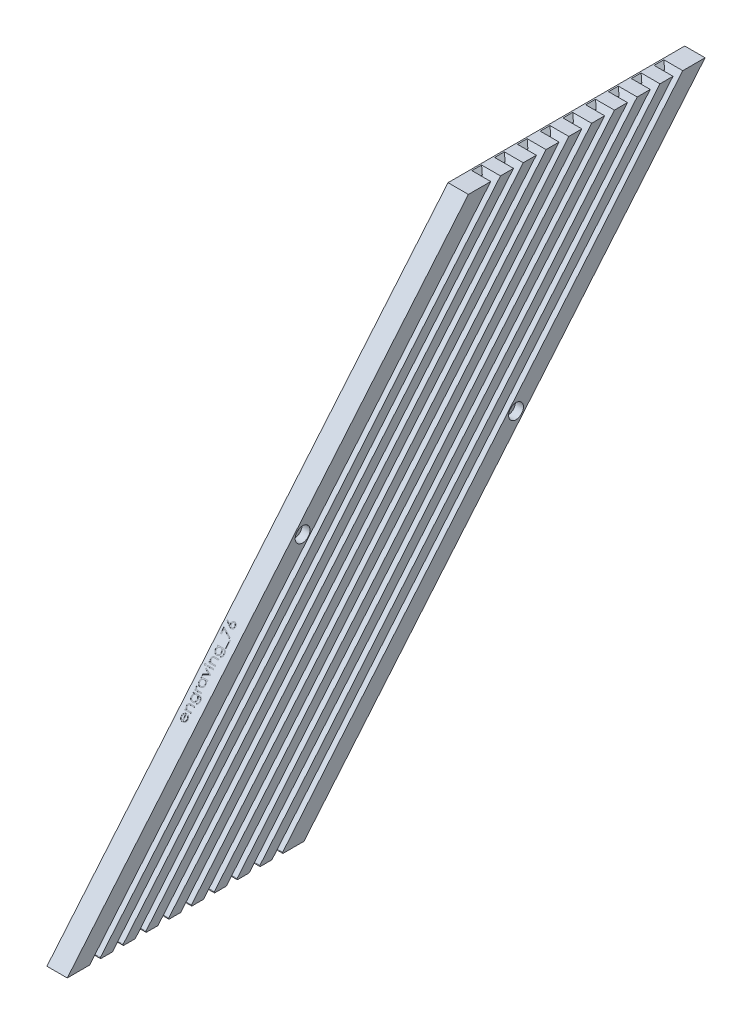
from build123d import *

# Parameters (mm, degrees)
BOSS_EXTRUDE1_DEPTH                                 = 13.673543
SKETCH2_W                                           = 5.003816
SKETCH2_H                                           = 9.673543
CUT_EXTRUDE1_DEPTH                                  = 292.510956164
CHAMFER1_SIZE                                       = 3
FILLET1_R                                           = 0.5
LPATTERN1_COUNT                                     = 9
LPATTERN1_PITCH                                     = 15.300152
CHAMFER1_OF_LPATTERN1_SIZE                          = 3
FILLET1_OF_LPATTERN1_R                              = 0.5
POG_BIENIE_WALCOWE_POD_M5_WKR_T_Z_BEM_W_D           = 5.5
POG_BIENIE_WALCOWE_POD_M5_WKR_T_Z_BEM_W_CBORE_D     = 10
POG_BIENIE_WALCOWE_POD_M5_WKR_T_Z_BEM_W_CBORE_DEPTH = 5.4
SZKIC3_W                                            = 0.538461539
SZKIC3_H                                            = 4.384615385
SZKIC3_W_2                                          = 4.307692308
SZKIC3_H_2                                          = 0.384615385
WYTNIJ_WYCI_GNI_CIE1_DEPTH                          = 0.1


with BuildPart() as part:
    # Boss-Extrude1: read off the stored shape, not the designer's step
    # Boss-Extrude1 outline → Boss-Extrude1 (new body)
    with BuildSketch(Plane(origin=(0, 0, 0), x_dir=(0, 0, -1), z_dir=(1, 0, 0))):
        Polygon((198.628457678, 142), (39.675837577, 142), (-229.675144031, -179), (-70.72252393, -179), align=None)
    extrude(amount=BOSS_EXTRUDE1_DEPTH)

    # Sketch2 → Cut-Extrude1 (cut, symmetric)
    with BuildSketch(Plane(origin=(0, 0, 0), x_dir=(0, -0.6427876096865378, -0.7660444431189795), z_dir=(0, -0.7660444431189793, 0.6427876096865377))):
        with Locations((-46.882385674, 8.8367715)):
            Rectangle(SKETCH2_W, SKETCH2_H)
    cut_extrude1 = extrude(amount=CUT_EXTRUDE1_DEPTH, both=True, mode=Mode.SUBTRACT)

    # Chamfer1
    chamfer1_edges = [part.edges().sort_by_distance(p)[0] for p in [
        (4, 142, -57.951539627),
    ]]
    chamfer(chamfer1_edges, length=CHAMFER1_SIZE)

    # Fillet1
    fillet1_edges = [part.edges().sort_by_distance(p)[0] for p in [
        (8.8367715, -179, 208.13343304),
    ]]
    fillet(fillet1_edges, radius=FILLET1_R)

    # LPattern1: Cut-Extrude1 ×9
    with Locations(*[(0, 0, -i * LPATTERN1_PITCH) for i in range(1, LPATTERN1_COUNT)]):
        add(cut_extrude1, mode=Mode.SUBTRACT)

    # Chamfer1 of LPattern1
    chamfer1_of_lpattern1_edges = [part.edges().sort_by_distance(p)[0] for p in [
        (4, 142, -73.251691627),
        (4, 142, -88.551843627),
        (4, 142, -103.851995627),
        (4, 142, -119.152147627),
        (4, 142, -134.452299627),
        (4, 142, -149.752451627),
        (4, 142, -165.052603627),
        (4, 142, -180.352755627),
    ]]
    chamfer(chamfer1_of_lpattern1_edges, length=CHAMFER1_OF_LPATTERN1_SIZE)

    # Fillet1 of LPattern1
    fillet1_of_lpattern1_edges = [part.edges().sort_by_distance(p)[0] for p in [
        (8.8367715, -179, 192.83328104),
        (8.8367715, -179, 177.53312904),
        (8.8367715, -179, 162.23297704),
        (8.8367715, -179, 146.93282504),
        (8.8367715, -179, 131.63267304),
        (8.8367715, -179, 116.33252104),
        (8.8367715, -179, 101.03236904),
        (8.8367715, -179, 85.73221704),
    ]]
    fillet(fillet1_of_lpattern1_edges, radius=FILLET1_OF_LPATTERN1_R)

    # Pogłębienie walcowe pod M5 Wkręt z łbem walcowym z gniazdem sześciokątnym1 (through all)
    with Locations(Plane(origin=(13.673543, 0, 0), x_dir=(0, 0, -1), z_dir=(1, 0, 0))):
        with Locations((-71.643866315, 0), (71.643866315, 0)):
            CounterBoreHole(POG_BIENIE_WALCOWE_POD_M5_WKR_T_Z_BEM_W_D / 2, POG_BIENIE_WALCOWE_POD_M5_WKR_T_Z_BEM_W_CBORE_D / 2, POG_BIENIE_WALCOWE_POD_M5_WKR_T_Z_BEM_W_CBORE_DEPTH)

    # Szkic3 → Wytnij-wyciągnięcie1 (cut)
    # profile 1 of 13: a face of its own
    with BuildSketch(Plane(origin=(-113.144209161, -42.033178412, 114.746334553), x_dir=(0, 0.7660444431189793, -0.6427876096865379), z_dir=(0, 0.6427876096865379, 0.7660444431189793))):
        with BuildLine():
            Line((-41.876053252, -119.430663267), (-41.397687867, -119.681865191))
            add(Edge.make_bspline(
                [(-41.397687867, -119.681865191), (-41.435807745, -119.74948233), (-41.509973931, -119.881038506), (-41.63751807, -120.061778838), (-41.771218766, -120.224374923), (-41.917111282, -120.364482901), (-42.070830732, -120.486628133), (-42.233229569, -120.593492975), (-42.405153256, -120.684553296), (-42.586609927, -120.761271915), (-42.779123444, -120.820259619), (-42.983160329, -120.861923998), (-43.199111464, -120.887678173), (-43.347133486, -120.890669843), (-43.422928252, -120.892201729)],
                knots=[0, 0, 0, 0, 1.120438281, 2.179929193, 3.190490725, 4.156257408, 5.095198341, 6.022838206, 6.959905092, 7.901321166, 8.864066838, 9.862729781, 10.905609505, 12, 12, 12, 12], degree=3))
            add(Edge.make_bspline(
                [(-43.422928252, -120.892201729), (-43.507171642, -120.890235143), (-43.67150609, -120.886398903), (-43.910717085, -120.853326106), (-44.135938946, -120.799373492), (-44.347159008, -120.724003992), (-44.543860013, -120.625557151), (-44.726432907, -120.50562661), (-44.895837808, -120.364828459), (-45.046736453, -120.201943128), (-45.182583109, -120.027631201), (-45.302455943, -119.845992542), (-45.402668682, -119.657484157), (-45.484187442, -119.463306116), (-45.550024354, -119.264682298), (-45.595910131, -119.059805497), (-45.622361128, -118.849230209), (-45.626414463, -118.706777634), (-45.628457098, -118.634990191)],
                knots=[0, 0, 0, 0, 1.145258523, 2.234067595, 3.276747158, 4.290159414, 5.277019952, 6.260822364, 7.254936242, 8.264827045, 9.274100331, 10.257902744, 11.220704747, 12.172965371, 13.118907548, 14.062713208, 15.023725156, 16, 16, 16, 16], degree=3))
            add(Edge.make_bspline(
                [(-45.628457098, -118.634990191), (-45.626641427, -118.567627624), (-45.623043007, -118.434123913), (-45.600361657, -118.236525837), (-45.560164584, -118.044477061), (-45.505005171, -117.857818007), (-45.433774463, -117.676861206), (-45.346633516, -117.501496526), (-45.243446583, -117.331910572), (-45.163779142, -117.224933771), (-45.123649406, -117.171047883)],
                knots=[0, 0, 0, 0, 1.024358464, 2.0301432, 3.019427413, 4.004406732, 4.986367066, 5.972626655, 6.978780325, 8, 8, 8, 8], degree=3))
            add(Edge.make_bspline(
                [(-45.123649406, -117.171047883), (-45.069293378, -117.10612982), (-44.962303184, -116.978350133), (-44.781349432, -116.810455861), (-44.585406238, -116.669809389), (-44.376929165, -116.553225727), (-44.153495209, -116.464642332), (-43.918107853, -116.398629334), (-43.668086848, -116.361638458), (-43.497163612, -116.3564136), (-43.409707098, -116.353740191)],
                knots=[0, 0, 0, 0, 1.030682036, 2.02871468, 2.997146059, 3.962720338, 4.930598197, 5.918074684, 6.934738563, 8, 8, 8, 8], degree=3))
            add(Edge.make_bspline(
                [(-43.409707098, -116.353740191), (-43.319796917, -116.356061417), (-43.143413639, -116.360615135), (-42.886215717, -116.402831706), (-42.642854488, -116.469778943), (-42.413427338, -116.564328298), (-42.197911006, -116.686316101), (-41.997706349, -116.837416401), (-41.80938947, -117.012990264), (-41.699831907, -117.148012909), (-41.644082098, -117.21672096)],
                knots=[0, 0, 0, 0, 1.056321875, 2.072262726, 3.055038591, 4.01806755, 4.982017516, 5.957941055, 6.960871419, 8, 8, 8, 8], degree=3))
            add(Edge.make_bspline(
                [(-41.644082098, -117.21672096), (-41.606150204, -117.268498528), (-41.530538901, -117.371709017), (-41.435829587, -117.540002429), (-41.35361691, -117.716077734), (-41.287903262, -117.9027811), (-41.234692689, -118.097900381), (-41.196195285, -118.302830457), (-41.173618796, -118.517510305), (-41.169181029, -118.6637844), (-41.166918636, -118.738355575)],
                knots=[0, 0, 0, 0, 0.94817472, 1.890038105, 2.849395472, 3.817997239, 4.812318967, 5.836947057, 6.897266129, 8, 8, 8, 8], degree=3))
            Line((-41.166918636, -118.738355575), (-45.089995559, -118.738355575))
            add(Edge.make_bspline(
                [(-45.089995559, -118.738355575), (-45.087356234, -118.7961278), (-45.082166107, -118.909734549), (-45.057968719, -119.075970177), (-45.019827964, -119.234324478), (-44.966223857, -119.383609693), (-44.901309265, -119.525775626), (-44.821790893, -119.659767689), (-44.726923086, -119.784975569), (-44.621107602, -119.902519233), (-44.50332401, -120.007194824), (-44.379410729, -120.100883583), (-44.247593189, -120.179407463), (-44.10891076, -120.243144417), (-43.9635877, -120.293040959), (-43.811578222, -120.32710008), (-43.653181451, -120.349912263), (-43.545205907, -120.352448832), (-43.490235944, -120.353740191)],
                knots=[0, 0, 0, 0, 1.094153842, 2.151609401, 3.174256925, 4.172055639, 5.149267565, 6.128595816, 7.11444997, 8.118368179, 9.117203808, 10.09244225, 11.054858984, 12.015122123, 12.976791628, 13.957293641, 14.960065497, 16, 16, 16, 16], degree=3))
            add(Edge.make_bspline(
                [(-43.490235944, -120.353740191), (-43.43649112, -120.352697808), (-43.329851078, -120.35062952), (-43.17103818, -120.330517673), (-43.01479899, -120.2979972), (-42.861780161, -120.25361436), (-42.715087283, -120.199482614), (-42.579237768, -120.134163429), (-42.454300256, -120.061906721), (-42.337528313, -119.979261563), (-42.224263753, -119.878104671), (-42.111905205, -119.751872007), (-41.991430942, -119.602579102), (-41.916020212, -119.490215103), (-41.876053252, -119.430663267)],
                knots=[0, 0, 0, 0, 0.99110716, 1.966546729, 2.947904876, 3.932708344, 4.903319531, 5.828989031, 6.710028674, 7.56322171, 8.463672341, 9.504779593, 10.677557249, 12, 12, 12, 12], degree=3))
        make_face()
        with BuildLine():
            add(Edge.make_bspline(
                [(-41.705380175, -118.199894037), (-41.725088674, -118.128471967), (-41.763021191, -117.991007475), (-41.84228353, -117.800651663), (-41.931549028, -117.631472404), (-42.037186282, -117.484764462), (-42.156875526, -117.354472725), (-42.295124411, -117.240612293), (-42.450157371, -117.138753806), (-42.621173041, -117.052778092), (-42.802273244, -116.979595477), (-42.991883858, -116.93052385), (-43.185354352, -116.896907492), (-43.316213128, -116.893777021), (-43.382062867, -116.892201729)],
                knots=[0, 0, 0, 0, 1.154881502, 2.222775134, 3.210006277, 4.132804581, 5.035138423, 5.962687519, 6.919655026, 7.923214229, 8.944639381, 9.960483929, 10.97369054, 12, 12, 12, 12], degree=3))
            add(Edge.make_bspline(
                [(-43.382062867, -116.892201729), (-43.435804762, -116.893250309), (-43.542041189, -116.895323131), (-43.698557306, -116.914986209), (-43.848865361, -116.947488801), (-43.994074425, -116.992000155), (-44.132281628, -117.051329188), (-44.266329802, -117.120900433), (-44.392810482, -117.205828863), (-44.471909845, -117.270558328), (-44.511870559, -117.303259421)],
                knots=[0, 0, 0, 0, 1.04873581, 2.073130211, 3.073294108, 4.04793562, 5.032784715, 6.005352987, 6.992311501, 8, 8, 8, 8], degree=3))
            add(Edge.make_bspline(
                [(-44.511870559, -117.303259421), (-44.540487614, -117.329135391), (-44.598401559, -117.381502047), (-44.67578531, -117.471723544), (-44.749877549, -117.569011936), (-44.817306668, -117.677089293), (-44.879153959, -117.794724914), (-44.937028205, -117.920926574), (-44.989119197, -118.05665194), (-45.018426815, -118.151233265), (-45.033505175, -118.199894037)],
                knots=[0, 0, 0, 0, 0.879870761, 1.780643979, 2.707998968, 3.669668524, 4.684282772, 5.740141944, 6.837334558, 8, 8, 8, 8], degree=3))
            Line((-45.033505175, -118.199894037), (-41.705380175, -118.199894037))
        make_face(mode=Mode.SUBTRACT)
    # profile 2 of 13: a face of its own
    with BuildSketch(Plane(origin=(-113.144209161, -42.033178412, 114.746334553), x_dir=(0, 0.7660444431189793, -0.6427876096865379), z_dir=(0, 0.6427876096865379, 0.7660444431189793))):
        with BuildLine():
            Line((-40.089995559, -116.430663267), (-39.551534021, -116.430663267))
            Line((-39.551534021, -116.430663267), (-39.551534021, -117.221528652))
            add(Edge.make_bspline(
                [(-39.551534021, -117.221528652), (-39.494040932, -117.14979827), (-39.382473588, -117.010602961), (-39.196671873, -116.827653405), (-39.000310901, -116.676890162), (-38.794593181, -116.556712229), (-38.579239449, -116.466118013), (-38.355562415, -116.400690703), (-38.122222919, -116.361459568), (-37.963541027, -116.356333459), (-37.88326479, -116.353740191)],
                knots=[0, 0, 0, 0, 1.12780773, 2.188550248, 3.19190651, 4.159438251, 5.104880172, 6.052711206, 7.014878035, 8, 8, 8, 8], degree=3))
            add(Edge.make_bspline(
                [(-37.88326479, -116.353740191), (-37.80212656, -116.356731954), (-37.643319473, -116.362587557), (-37.412099939, -116.408901885), (-37.19614555, -116.488008036), (-36.996226311, -116.596371586), (-36.816008231, -116.73112554), (-36.657737057, -116.888116023), (-36.526828633, -117.068692166), (-36.439061725, -117.236217577), (-36.381246329, -117.384826938), (-36.344848036, -117.512107081), (-36.313937782, -117.653909626), (-36.2871405, -117.809806064), (-36.269008308, -117.980888676), (-36.254707237, -118.166456148), (-36.244458047, -118.366448372), (-36.244051406, -118.504768305), (-36.243841713, -118.57609596)],
                knots=[0, 0, 0, 0, 1.235846778, 2.418850247, 3.575807741, 4.728682307, 5.871620074, 6.994088408, 8.11269785, 9.256955736, 9.865816715, 10.540099792, 11.271859618, 12.076849838, 12.949306005, 13.892391288, 14.913166135, 16, 16, 16, 16], degree=3))
            Line((-36.243841713, -118.57609596), (-36.243841713, -120.815278652))
            Line((-36.243841713, -120.815278652), (-36.782303252, -120.815278652))
            Line((-36.782303252, -120.815278652), (-36.782303252, -118.752778652))
            add(Edge.make_bspline(
                [(-36.782303252, -118.752778652), (-36.782634465, -118.693083032), (-36.783268021, -118.578895471), (-36.785266272, -118.415405717), (-36.790083084, -118.267143011), (-36.79685162, -118.13446181), (-36.80675853, -118.017489518), (-36.817083041, -117.915987901), (-36.829708715, -117.830085828), (-36.840959423, -117.778374259), (-36.846005175, -117.755182498)],
                knots=[0, 0, 0, 0, 1.430800155, 2.736877192, 3.918605307, 4.986035426, 5.920637409, 6.731861385, 7.431261377, 8, 8, 8, 8], degree=3))
            add(Edge.make_bspline(
                [(-36.846005175, -117.755182498), (-36.864220372, -117.687106181), (-36.89927899, -117.556080333), (-36.985908675, -117.378352872), (-37.095304414, -117.227155978), (-37.228843584, -117.103424455), (-37.385236285, -117.007131592), (-37.56404853, -116.940319099), (-37.763554771, -116.898531209), (-37.90387657, -116.894370411), (-37.97701479, -116.892201729)],
                knots=[0, 0, 0, 0, 1.084156227, 2.086665306, 3.027808233, 3.945421172, 4.874247719, 5.839848303, 6.874090471, 8, 8, 8, 8], degree=3))
            add(Edge.make_bspline(
                [(-37.97701479, -116.892201729), (-38.020330819, -116.893017737), (-38.106052122, -116.894632596), (-38.233166359, -116.910834821), (-38.356464942, -116.93733503), (-38.4771853, -116.973109838), (-38.592912946, -117.022245156), (-38.707366017, -117.078009791), (-38.816234755, -117.147521012), (-38.921840579, -117.224990648), (-39.020091107, -117.310840718), (-39.111511115, -117.401431307), (-39.193004864, -117.49790377), (-39.266836879, -117.59870368), (-39.330571045, -117.705215403), (-39.38620491, -117.816411357), (-39.433408958, -117.932437897), (-39.456865002, -118.012966574), (-39.468601329, -118.053259421)],
                knots=[0, 0, 0, 0, 1.023777757, 2.026029729, 3.023749952, 4.003683103, 4.997618607, 5.993177895, 7.010360494, 8.046726602, 9.087585522, 10.09234134, 11.086953743, 12.070360549, 13.043493632, 14.017870808, 15.008233677, 16, 16, 16, 16], degree=3))
            add(Edge.make_bspline(
                [(-39.468601329, -118.053259421), (-39.475355012, -118.082839769), (-39.490057427, -118.14723464), (-39.505937164, -118.252910787), (-39.52035015, -118.375156459), (-39.532413508, -118.513829002), (-39.539794222, -118.669413931), (-39.547841759, -118.841246796), (-39.550771578, -119.030012776), (-39.551272757, -119.161432821), (-39.551534021, -119.229942114)],
                knots=[0, 0, 0, 0, 0.615963638, 1.340920617, 2.168419149, 3.115676021, 4.16674242, 5.331190069, 6.6087489, 8, 8, 8, 8], degree=3))
            Line((-39.551534021, -119.229942114), (-39.551534021, -120.815278652))
            Line((-39.551534021, -120.815278652), (-40.089995559, -120.815278652))
            Line((-40.089995559, -120.815278652), (-40.089995559, -116.430663267))
        make_face()
    # profile 3 of 13: a face of its own
    with BuildSketch(Plane(origin=(-113.144209161, -42.033178412, 114.746334553), x_dir=(0, 0.7660444431189793, -0.6427876096865379), z_dir=(0, 0.6427876096865379, 0.7660444431189793))):
        with BuildLine():
            Line((-31.166918636, -116.430663267), (-30.628457098, -116.430663267))
            Line((-30.628457098, -116.430663267), (-30.628457098, -119.910230575))
            add(Edge.make_bspline(
                [(-30.628457098, -119.910230575), (-30.628932028, -119.984352166), (-30.629848758, -120.127424691), (-30.636450423, -120.334301741), (-30.650371584, -120.525386459), (-30.666157894, -120.701550331), (-30.688866551, -120.861976806), (-30.716597466, -121.007144585), (-30.74785863, -121.137192978), (-30.77532186, -121.217292705), (-30.788312867, -121.255182498)],
                knots=[0, 0, 0, 0, 1.307562039, 2.523909702, 3.650326591, 4.686913197, 5.643429486, 6.506965704, 7.293745905, 8, 8, 8, 8], degree=3))
            add(Edge.make_bspline(
                [(-30.788312867, -121.255182498), (-30.807494419, -121.304433792), (-30.845284007, -121.401463799), (-30.916059379, -121.539008349), (-30.9953175, -121.668516446), (-31.085843358, -121.789266362), (-31.187227593, -121.900651926), (-31.29708158, -122.005093068), (-31.417544765, -122.100380212), (-31.548548272, -122.184869293), (-31.687072214, -122.260961386), (-31.833036961, -122.326869787), (-31.985619427, -122.384275805), (-32.146252955, -122.427274883), (-32.312419071, -122.464534404), (-32.48607181, -122.488782437), (-32.666196605, -122.505285965), (-32.788674399, -122.506812079), (-32.850812867, -122.507586344)],
                knots=[0, 0, 0, 0, 0.981931301, 1.934503488, 2.87077864, 3.801706999, 4.735015492, 5.667491629, 6.616593066, 7.585388521, 8.561939025, 9.551802639, 10.560317337, 11.588439944, 12.640189604, 13.723962949, 14.845264515, 16, 16, 16, 16], degree=3))
            add(Edge.make_bspline(
                [(-32.850812867, -122.507586344), (-32.941472412, -122.506118083), (-33.118554861, -122.503250174), (-33.376734849, -122.469837177), (-33.621937226, -122.422601109), (-33.850922009, -122.35110609), (-34.062242175, -122.263614107), (-34.254454533, -122.163165617), (-34.425833574, -122.047983944), (-34.580331299, -121.916840057), (-34.719774025, -121.760902317), (-34.850963665, -121.57713287), (-34.977239565, -121.362732489), (-35.051242945, -121.205373552), (-35.089995559, -121.12297096)],
                knots=[0, 0, 0, 0, 1.157897085, 2.2616841, 3.32207898, 4.345638746, 5.321241055, 6.241986252, 7.112515963, 7.955008012, 8.825025602, 9.77857164, 10.836726669, 12, 12, 12, 12], degree=3))
            Line((-35.089995559, -121.12297096), (-34.551534021, -121.12297096))
            add(Edge.make_bspline(
                [(-34.551534021, -121.12297096), (-34.508227376, -121.19172389), (-34.423568219, -121.326127401), (-34.265256538, -121.500149954), (-34.091759978, -121.648870008), (-33.897223378, -121.768717049), (-33.680837295, -121.859076692), (-33.442471547, -121.923491486), (-33.180186481, -121.962056515), (-32.997583828, -121.966704447), (-32.902495559, -121.969124806)],
                knots=[0, 0, 0, 0, 0.997731894, 1.950442991, 2.880492273, 3.800895997, 4.748200782, 5.754801363, 6.83083817, 8, 8, 8, 8], degree=3))
            add(Edge.make_bspline(
                [(-32.902495559, -121.969124806), (-32.808609462, -121.966673122), (-32.627606463, -121.961946522), (-32.367324459, -121.923474274), (-32.129733136, -121.859062674), (-31.916201364, -121.768876869), (-31.729248618, -121.658390458), (-31.568085204, -121.534961759), (-31.437551474, -121.395794325), (-31.349757817, -121.267596943), (-31.295184186, -121.153384149), (-31.26043178, -121.055065413), (-31.23219069, -120.943889052), (-31.208568111, -120.820227789), (-31.189075117, -120.683904949), (-31.176727319, -120.534608829), (-31.16780307, -120.372678733), (-31.167220265, -120.260404782), (-31.166918636, -120.202297883)],
                knots=[0, 0, 0, 0, 1.570740765, 3.028230971, 4.391408896, 5.680370741, 6.894727393, 8.017376726, 9.065722033, 10.075533815, 10.603371122, 11.180248986, 11.817768598, 12.521299649, 13.286540596, 14.121245857, 15.027658897, 16, 16, 16, 16], degree=3))
            Line((-31.166918636, -120.202297883), (-31.166918636, -119.975134421))
            add(Edge.make_bspline(
                [(-31.166918636, -119.975134421), (-31.22157198, -120.040177511), (-31.329917333, -120.169119602), (-31.517027037, -120.338082407), (-31.721398892, -120.483601488), (-31.942684965, -120.602947718), (-32.175464809, -120.698401589), (-32.417217204, -120.765160951), (-32.665775012, -120.808292208), (-32.834207269, -120.812933321), (-32.919322483, -120.815278652)],
                knots=[0, 0, 0, 0, 1.012485704, 2.007162095, 2.997754123, 3.998611389, 4.999708251, 5.992315798, 6.98544096, 8, 8, 8, 8], degree=3))
            add(Edge.make_bspline(
                [(-32.919322483, -120.815278652), (-32.969441802, -120.81439575), (-33.069087329, -120.812640393), (-33.217124038, -120.797282489), (-33.362976218, -120.77499893), (-33.50630371, -120.742287892), (-33.647313333, -120.700302075), (-33.785772062, -120.647816237), (-33.922800965, -120.588476035), (-34.055909247, -120.5185798), (-34.183771185, -120.440815846), (-34.30542236, -120.356577747), (-34.420225569, -120.266306396), (-34.527088123, -120.169111642), (-34.625869845, -120.065134157), (-34.717899333, -119.955482352), (-34.801654786, -119.838625081), (-34.878854881, -119.716693154), (-34.945810682, -119.588874427), (-35.004583891, -119.45794055), (-35.055685728, -119.324171485), (-35.096426417, -119.187119377), (-35.127542611, -119.046870631), (-35.150703, -118.903655004), (-35.163839454, -118.757031482), (-35.165887896, -118.658252027), (-35.166918636, -118.608547883)],
                knots=[0, 0, 0, 0, 1.028754217, 2.045334182, 3.052854819, 4.056607503, 5.061168794, 6.071104265, 7.095078842, 8.125279047, 9.155117945, 10.165957491, 11.161587969, 12.151493252, 13.128948131, 14.104219989, 15.088194871, 16.07871515, 17.064853787, 18.047899887, 19.02414258, 20.002704429, 20.980574569, 21.971845993, 22.979467364, 24, 24, 24, 24], degree=3))
            add(Edge.make_bspline(
                [(-35.166918636, -118.608547883), (-35.166028637, -118.55882829), (-35.164252085, -118.459581675), (-35.148907549, -118.312359871), (-35.127019225, -118.167109411), (-35.092377335, -118.025327453), (-35.050681582, -117.885399308), (-34.999041172, -117.748358525), (-34.93695187, -117.614163367), (-34.866649442, -117.482714456), (-34.787648141, -117.355775687), (-34.701021031, -117.235215723), (-34.606663532, -117.121921714), (-34.505877391, -117.014750705), (-34.39743199, -116.914736716), (-34.281383432, -116.822122491), (-34.158875637, -116.735355589), (-34.029528923, -116.656307582), (-33.895339114, -116.58639516), (-33.759715426, -116.522602136), (-33.620861309, -116.471972217), (-33.481365527, -116.42736119), (-33.338771388, -116.395757998), (-33.194827284, -116.371377012), (-33.04904042, -116.356523205), (-32.951406885, -116.354669059), (-32.902495559, -116.353740191)],
                knots=[0, 0, 0, 0, 1.008818848, 2.013730394, 3.001654427, 3.987803273, 4.973046549, 5.963777569, 6.957074694, 7.972068341, 8.987420212, 9.989399531, 10.982630087, 11.977756091, 12.973280677, 13.973972381, 14.989194003, 16.018387222, 17.047741039, 18.059210846, 19.057554164, 20.045176975, 21.029480261, 22.018708529, 23.007435371, 24, 24, 24, 24], degree=3))
            add(Edge.make_bspline(
                [(-32.902495559, -116.353740191), (-32.821836807, -116.356065916), (-32.662560554, -116.36065851), (-32.42816455, -116.396694759), (-32.201977853, -116.454147353), (-31.982724112, -116.536459863), (-31.768617282, -116.648831357), (-31.560363015, -116.796847839), (-31.357358785, -116.981836993), (-31.232082504, -117.123699046), (-31.166918636, -117.197490191)],
                knots=[0, 0, 0, 0, 0.96728863, 1.910097829, 2.838038873, 3.762875196, 4.71315279, 5.730631239, 6.819562287, 8, 8, 8, 8], degree=3))
            Line((-31.166918636, -117.197490191), (-31.166918636, -116.430663267))
        make_face()
        with BuildLine():
            add(Edge.make_bspline(
                [(-32.859226329, -116.892201729), (-32.937964678, -116.894877841), (-33.093849914, -116.900175976), (-33.322344216, -116.945406913), (-33.542933244, -117.016285599), (-33.751399693, -117.117672939), (-33.946669024, -117.241263062), (-34.119940145, -117.390989269), (-34.27149143, -117.561982749), (-34.399690752, -117.752697458), (-34.501744523, -117.958449931), (-34.573990385, -118.175325475), (-34.620704711, -118.399819748), (-34.625860686, -118.553029925), (-34.628457098, -118.630182498)],
                knots=[0, 0, 0, 0, 1.026226791, 2.031711442, 3.026614839, 4.04107745, 5.047145931, 6.032893242, 7.017642609, 8.019221815, 9.021877557, 10.003543541, 10.994637589, 12, 12, 12, 12], degree=3))
            add(Edge.make_bspline(
                [(-34.628457098, -118.630182498), (-34.627212943, -118.688353823), (-34.624766055, -118.802759807), (-34.601239922, -118.97065334), (-34.56321541, -119.130562449), (-34.509323057, -119.282496806), (-34.442547008, -119.427327883), (-34.358560086, -119.564057999), (-34.259729849, -119.692808924), (-34.146829841, -119.812628379), (-34.022413187, -119.921761467), (-33.887465988, -120.017655251), (-33.742171274, -120.096085058), (-33.590102457, -120.163869352), (-33.427569732, -120.213376325), (-33.256914156, -120.251157089), (-33.076928391, -120.272772102), (-32.95423398, -120.275451184), (-32.891678252, -120.276817114)],
                knots=[0, 0, 0, 0, 1.039728707, 2.044842319, 3.024901384, 3.974314358, 4.923051295, 5.871625912, 6.837440708, 7.820715446, 8.810779094, 9.792721783, 10.773906224, 11.758876063, 12.764959493, 13.806266761, 14.881525401, 16, 16, 16, 16], degree=3))
            add(Edge.make_bspline(
                [(-32.891678252, -120.276817114), (-32.828311809, -120.275501212), (-32.704399402, -120.272927982), (-32.523420654, -120.250807698), (-32.351935956, -120.215112882), (-32.190102546, -120.16443341), (-32.03730939, -120.099767552), (-31.895272908, -120.01793335), (-31.760947569, -119.924737181), (-31.638622295, -119.816030871), (-31.52800944, -119.696228022), (-31.431613839, -119.565865345), (-31.349474784, -119.426904455), (-31.281455921, -119.279361017), (-31.229528143, -119.122088412), (-31.194695734, -118.955479802), (-31.170341314, -118.780333392), (-31.168076872, -118.660318622), (-31.166918636, -118.598932498)],
                knots=[0, 0, 0, 0, 1.121943988, 2.193949579, 3.223793937, 4.220241907, 5.192961521, 6.155822191, 7.11847367, 8.083710714, 9.04790392, 10.001595906, 10.949595423, 11.902125208, 12.873731292, 13.87582262, 14.913508608, 16, 16, 16, 16], degree=3))
            add(Edge.make_bspline(
                [(-31.166918636, -118.598932498), (-31.169215039, -118.519016177), (-31.173701403, -118.362887769), (-31.216039387, -118.135390452), (-31.284302605, -117.921501297), (-31.380039894, -117.721896767), (-31.500009052, -117.538691825), (-31.64450765, -117.37527952), (-31.811043702, -117.23144948), (-31.999138731, -117.111624005), (-32.20150578, -117.014826118), (-32.413256402, -116.942205937), (-32.634076226, -116.901072825), (-32.783744357, -116.89517578), (-32.859226329, -116.892201729)],
                knots=[0, 0, 0, 0, 1.070913519, 2.092188694, 3.091357305, 4.074328408, 5.051968682, 6.018948707, 6.99050112, 7.9935919, 9.000589572, 9.992915277, 10.987769056, 12, 12, 12, 12], degree=3))
        make_face(mode=Mode.SUBTRACT)
    # profile 4 of 13: a face of its own
    with BuildSketch(Plane(origin=(-113.144209161, -42.033178412, 114.746334553), x_dir=(0, 0.7660444431189793, -0.6427876096865379), z_dir=(0, 0.6427876096865379, 0.7660444431189793))):
        with BuildLine():
            Line((-29.551534021, -116.430663267), (-29.013072483, -116.430663267))
            Line((-29.013072483, -116.430663267), (-29.013072483, -117.07609596))
            add(Edge.make_bspline(
                [(-29.013072483, -117.07609596), (-28.973320325, -117.016000254), (-28.897294632, -116.901067684), (-28.77092961, -116.749063168), (-28.641495328, -116.623208802), (-28.508372149, -116.522917056), (-28.370581121, -116.447808852), (-28.231146347, -116.392792221), (-28.087874113, -116.36025968), (-27.991596528, -116.355916265), (-27.943360944, -116.353740191)],
                knots=[0, 0, 0, 0, 1.2804753, 2.448899062, 3.506932113, 4.484331642, 5.4025378, 6.288909075, 7.142734305, 8, 8, 8, 8], degree=3))
            add(Edge.make_bspline(
                [(-27.943360944, -116.353740191), (-27.905944384, -116.355781093), (-27.828957381, -116.359980383), (-27.712415799, -116.389484654), (-27.59234131, -116.436589836), (-27.51495436, -116.48088736), (-27.474610944, -116.503980575)],
                knots=[0, 0, 0, 0, 0.901110191, 1.854092781, 2.881294221, 4, 4, 4, 4], degree=3))
            Line((-27.474610944, -116.503980575), (-27.770284021, -116.970326729))
            add(Edge.make_bspline(
                [(-27.770284021, -116.970326729), (-27.7961852, -116.958771987), (-27.845350596, -116.936838875), (-27.91727271, -116.910881143), (-27.983583573, -116.895596716), (-28.025829673, -116.8932812), (-28.045524406, -116.892201729)],
                knots=[0, 0, 0, 0, 1.180555205, 2.24091978, 3.179933427, 4, 4, 4, 4], degree=3))
            add(Edge.make_bspline(
                [(-28.045524406, -116.892201729), (-28.088734234, -116.895081793), (-28.17686976, -116.900956289), (-28.306271759, -116.947137102), (-28.431838397, -117.0217518), (-28.531561247, -117.104502277), (-28.608776537, -117.184298501), (-28.663874067, -117.253981477), (-28.714415919, -117.332116274), (-28.762707725, -117.41736716), (-28.806707087, -117.511189754), (-28.847772234, -117.612646691), (-28.884901713, -117.721855483), (-28.906073561, -117.797939804), (-28.916918636, -117.836913267)],
                knots=[0, 0, 0, 0, 1.125678352, 2.296057538, 3.5422874, 4.923748041, 5.663163013, 6.437101912, 7.23742474, 8.08941207, 8.991984279, 9.93940061, 10.944477711, 12, 12, 12, 12], degree=3))
            add(Edge.make_bspline(
                [(-28.916918636, -117.836913267), (-28.925031311, -117.871674136), (-28.943000268, -117.94866682), (-28.960471476, -118.077835719), (-28.977733506, -118.230447706), (-28.989899138, -118.406927579), (-29.001175782, -118.606834626), (-29.007535923, -118.83047339), (-29.012855592, -119.07807342), (-29.012997992, -119.251172312), (-29.013072483, -119.34172096)],
                knots=[0, 0, 0, 0, 0.566838948, 1.255505196, 2.06880316, 3.007127437, 4.065329342, 5.249902469, 6.561414163, 8, 8, 8, 8], degree=3))
            Line((-29.013072483, -119.34172096), (-29.013072483, -120.815278652))
            Line((-29.013072483, -120.815278652), (-29.551534021, -120.815278652))
            Line((-29.551534021, -120.815278652), (-29.551534021, -116.430663267))
        make_face()
    # profile 5 of 13: a face of its own
    with BuildSketch(Plane(origin=(-113.144209161, -42.033178412, 114.746334553), x_dir=(0, 0.7660444431189793, -0.6427876096865379), z_dir=(0, 0.6427876096865379, 0.7660444431189793))):
        with BuildLine():
            Line((-22.474610944, -116.430663267), (-22.474610944, -120.815278652))
            Line((-22.474610944, -120.815278652), (-23.013072483, -120.815278652))
            Line((-23.013072483, -120.815278652), (-23.013072483, -120.056865191))
            add(Edge.make_bspline(
                [(-23.013072483, -120.056865191), (-23.073790409, -120.125504494), (-23.192282207, -120.259454959), (-23.390181266, -120.434452969), (-23.599955286, -120.57910152), (-23.820586122, -120.695929947), (-24.051874539, -120.783687758), (-24.293307831, -120.846064031), (-24.544984484, -120.886167748), (-24.716845664, -120.890172357), (-24.803937867, -120.892201729)],
                knots=[0, 0, 0, 0, 1.074387032, 2.096679803, 3.090159297, 4.057316773, 5.018401886, 5.985159533, 6.978961417, 8, 8, 8, 8], degree=3))
            add(Edge.make_bspline(
                [(-24.803937867, -120.892201729), (-24.881368645, -120.890099377), (-25.034065568, -120.885953444), (-25.258686843, -120.853789495), (-25.474844985, -120.802137001), (-25.682744252, -120.730306905), (-25.881039359, -120.635025496), (-26.071428096, -120.520954785), (-26.252924139, -120.385113362), (-26.422761063, -120.229819599), (-26.579158778, -120.061142479), (-26.716406674, -119.881235827), (-26.830840525, -119.690877592), (-26.926532092, -119.492477899), (-27.000240111, -119.284509466), (-27.051623484, -119.067691464), (-27.083749964, -118.842280252), (-27.087894183, -118.688783926), (-27.089995559, -118.610951729)],
                knots=[0, 0, 0, 0, 1.033919861, 2.038935746, 3.024066025, 3.998881131, 4.97069526, 5.957263378, 6.95902576, 7.993208707, 9.027059324, 10.027763471, 11.009749337, 11.988697705, 12.965288445, 13.950418724, 14.960734635, 16, 16, 16, 16], degree=3))
            add(Edge.make_bspline(
                [(-27.089995559, -118.610951729), (-27.087847608, -118.534728237), (-27.083601225, -118.384038506), (-27.051967134, -118.162417881), (-26.998771119, -117.948958005), (-26.924117666, -117.744346102), (-26.828388601, -117.548334588), (-26.711940451, -117.360784831), (-26.574764809, -117.181180149), (-26.416617826, -117.013743761), (-26.245301077, -116.85907985), (-26.062028967, -116.724664344), (-25.871360484, -116.608578317), (-25.670338181, -116.516600929), (-25.461937429, -116.442185322), (-25.244302951, -116.390700233), (-25.018340245, -116.360361968), (-24.864927973, -116.355968658), (-24.787110944, -116.353740191)],
                knots=[0, 0, 0, 0, 1.020392517, 2.01726096, 2.990465484, 3.961182959, 4.928053699, 5.906110375, 6.912531644, 7.948652711, 8.985773172, 9.998621852, 10.987621588, 11.969261332, 12.953316658, 13.946091881, 14.958173133, 16, 16, 16, 16], degree=3))
            add(Edge.make_bspline(
                [(-24.787110944, -116.353740191), (-24.697625471, -116.356204907), (-24.522148683, -116.361038101), (-24.265472096, -116.401259919), (-24.022652991, -116.469211577), (-23.791816958, -116.561641574), (-23.573792925, -116.684467967), (-23.370644952, -116.839405043), (-23.180246981, -117.025475649), (-23.069880766, -117.168396411), (-23.013072483, -117.241961344)],
                knots=[0, 0, 0, 0, 1.038897134, 2.037228247, 3.008116434, 3.962042015, 4.918381754, 5.904844433, 6.921570401, 8, 8, 8, 8], degree=3))
            Line((-23.013072483, -117.241961344), (-23.013072483, -116.430663267))
            Line((-23.013072483, -116.430663267), (-22.474610944, -116.430663267))
        make_face()
        with BuildLine():
            add(Edge.make_bspline(
                [(-24.779899406, -116.892201729), (-24.858609699, -116.895002251), (-25.013971299, -116.900530035), (-25.242046731, -116.943684599), (-25.460298298, -117.01548676), (-25.667634425, -117.113684305), (-25.86077994, -117.237162139), (-26.033397661, -117.386513082), (-26.186899435, -117.557662249), (-26.315999316, -117.749837296), (-26.421240168, -117.95585688), (-26.495240794, -118.17121306), (-26.544045219, -118.392021593), (-26.549031254, -118.541786197), (-26.551534021, -118.616961344)],
                knots=[0, 0, 0, 0, 1.031046209, 2.035121221, 3.029706178, 4.034933723, 5.034054252, 6.02443088, 7.017295772, 8.038157696, 9.050218397, 10.03989886, 11.016116709, 12, 12, 12, 12], degree=3))
            add(Edge.make_bspline(
                [(-26.551534021, -118.616961344), (-26.548337061, -118.691687242), (-26.541955672, -118.840846138), (-26.496097339, -119.061955698), (-26.419160413, -119.277362628), (-26.31417402, -119.485238616), (-26.182711234, -119.678239931), (-26.030330687, -119.85265157), (-25.855558776, -120.002633721), (-25.661968764, -120.128183848), (-25.455212244, -120.229605312), (-25.237782647, -120.30017498), (-25.013767267, -120.345736889), (-24.86144898, -120.35105885), (-24.784707098, -120.353740191)],
                knots=[0, 0, 0, 0, 0.979072187, 1.954306742, 2.945804271, 3.96968567, 4.997920485, 5.998718438, 6.996577872, 8.005894225, 9.015743152, 10.005417472, 10.995077863, 12, 12, 12, 12], degree=3))
            add(Edge.make_bspline(
                [(-24.784707098, -120.353740191), (-24.706798807, -120.350894538), (-24.551846945, -120.345234818), (-24.323094874, -120.301895506), (-24.101103509, -120.230291851), (-23.888896832, -120.131036206), (-23.691212036, -120.008023595), (-23.513787103, -119.864011439), (-23.363759729, -119.696520267), (-23.236572398, -119.512446347), (-23.136843112, -119.310654353), (-23.064198439, -119.09579574), (-23.021248886, -118.867863029), (-23.015835636, -118.712096297), (-23.013072483, -118.632586344)],
                knots=[0, 0, 0, 0, 1.01762866, 2.023962475, 3.030623092, 4.058876274, 5.077231937, 6.066672613, 7.034107872, 8.005628644, 8.981990164, 9.965428785, 10.961468474, 12, 12, 12, 12], degree=3))
            add(Edge.make_bspline(
                [(-23.013072483, -118.632586344), (-23.014717608, -118.572007206), (-23.017955735, -118.452768292), (-23.042693854, -118.277692548), (-23.082045156, -118.110149017), (-23.137495734, -117.94996155), (-23.210337935, -117.79801581), (-23.298191248, -117.653220792), (-23.402600591, -117.516329573), (-23.521885213, -117.389227165), (-23.652454131, -117.273296087), (-23.790616201, -117.169814532), (-23.938008339, -117.084805207), (-24.09215183, -117.014448741), (-24.253314118, -116.958461627), (-24.422806609, -116.921111295), (-24.59882773, -116.895465031), (-24.718906682, -116.893300949), (-24.779899406, -116.892201729)],
                knots=[0, 0, 0, 0, 1.050140795, 2.067009409, 3.05949893, 4.030605086, 5.00011959, 5.97591094, 6.962425594, 7.979863591, 8.993523472, 9.986985069, 10.967611495, 11.937549037, 12.921786183, 13.919465291, 14.943216303, 16, 16, 16, 16], degree=3))
        make_face(mode=Mode.SUBTRACT)
    # profile 6 of 13: a face of its own
    with BuildSketch(Plane(origin=(-113.144209161, -42.033178412, 114.746334553), x_dir=(0, 0.7660444431189793, -0.6427876096865379), z_dir=(0, 0.6427876096865379, 0.7660444431189793))):
        Polygon((-21.705380175, -116.430663267), (-21.122447483, -116.430663267), (-19.666918636, -119.62297096), (-18.21138979, -116.430663267), (-17.628457098, -116.430663267), (-19.628457098, -120.815278652), (-19.705380175, -120.815278652), align=None)
    # profile 7 of 13: a face of its own
    with BuildSketch(Plane(origin=(-113.144209161, -42.033178412, 114.746334553), x_dir=(0, 0.7660444431189793, -0.6427876096865379), z_dir=(0, 0.6427876096865379, 0.7660444431189793))):
        with BuildLine():
            add(Edge.make_bspline(
                [(-16.515476329, -114.584509421), (-16.482062644, -114.586059397), (-16.416632233, -114.589094547), (-16.322015203, -114.61508565), (-16.235860325, -114.659142254), (-16.159441354, -114.718250278), (-16.093866692, -114.78776361), (-16.047956902, -114.868782413), (-16.018449938, -114.956311508), (-16.0148867, -115.017365946), (-16.013072483, -115.048451729)],
                knots=[0, 0, 0, 0, 1.055194115, 2.066272739, 3.074728998, 4.095836921, 5.109056067, 6.073838105, 7.019297344, 8, 8, 8, 8], degree=3))
            add(Edge.make_bspline(
                [(-16.013072483, -115.048451729), (-16.014927614, -115.078730563), (-16.018594988, -115.138588234), (-16.047934111, -115.224599901), (-16.094257947, -115.304492958), (-16.159399306, -115.373871319), (-16.235871467, -115.432946667), (-16.322012243, -115.477011934), (-16.416633012, -115.503000741), (-16.482062908, -115.506036207), (-16.515476329, -115.507586344)],
                knots=[0, 0, 0, 0, 0.96129708, 1.900370562, 2.859976407, 3.87933698, 4.906634145, 5.921202961, 6.938410037, 8, 8, 8, 8], degree=3))
            add(Edge.make_bspline(
                [(-16.515476329, -115.507586344), (-16.548507658, -115.506095395), (-16.612798824, -115.503193458), (-16.705999125, -115.476501999), (-16.791419392, -115.432931588), (-16.867987402, -115.374258128), (-16.931810591, -115.304066876), (-16.978264863, -115.224648657), (-17.007536226, -115.138575821), (-17.011212732, -115.078726393), (-17.013072483, -115.048451729)],
                knots=[0, 0, 0, 0, 1.054934014, 2.053291228, 3.073705704, 4.106921865, 5.123545215, 6.088680038, 7.033164197, 8, 8, 8, 8], degree=3))
            add(Edge.make_bspline(
                [(-17.013072483, -115.048451729), (-17.011253477, -115.017370273), (-17.007680835, -114.956324331), (-16.978242922, -114.868732846), (-16.932197537, -114.788193129), (-16.867945142, -114.717863701), (-16.791430639, -114.659157241), (-16.705996219, -114.615595559), (-16.612799591, -114.588901834), (-16.548507918, -114.58600021), (-16.515476329, -114.584509421)],
                knots=[0, 0, 0, 0, 0.98631895, 1.937192651, 2.907499808, 3.917963147, 4.944918757, 5.95915025, 6.951458133, 8, 8, 8, 8], degree=3))
        make_face()
    # profile 8 of 13: a face of its own
    with BuildSketch(Plane(origin=(-113.144209161, -42.033178412, 114.746334553), x_dir=(0, 0.7660444431189793, -0.6427876096865379), z_dir=(0, 0.6427876096865379, 0.7660444431189793))):
        with Locations((-16.513072483, -118.62297096)):
            Rectangle(SZKIC3_W, SZKIC3_H)
    # profile 9 of 13: a face of its own
    with BuildSketch(Plane(origin=(-113.144209161, -42.033178412, 114.746334553), x_dir=(0, 0.7660444431189793, -0.6427876096865379), z_dir=(0, 0.6427876096865379, 0.7660444431189793))):
        with BuildLine():
            Line((-14.936149406, -116.430663267), (-14.397687867, -116.430663267))
            Line((-14.397687867, -116.430663267), (-14.397687867, -117.221528652))
            add(Edge.make_bspline(
                [(-14.397687867, -117.221528652), (-14.340194778, -117.14979827), (-14.228627434, -117.010602961), (-14.042825719, -116.827653405), (-13.846464748, -116.676890162), (-13.640747027, -116.556712229), (-13.425393296, -116.466118013), (-13.201716261, -116.400690703), (-12.968376765, -116.361459568), (-12.809694873, -116.356333459), (-12.729418636, -116.353740191)],
                knots=[0, 0, 0, 0, 1.12780773, 2.188550248, 3.19190651, 4.159438251, 5.104880172, 6.052711206, 7.014878035, 8, 8, 8, 8], degree=3))
            add(Edge.make_bspline(
                [(-12.729418636, -116.353740191), (-12.648280406, -116.356731954), (-12.489473319, -116.362587557), (-12.258253785, -116.408901885), (-12.042299396, -116.488008036), (-11.842380157, -116.596371586), (-11.662162077, -116.73112554), (-11.503890903, -116.888116023), (-11.372982479, -117.068692166), (-11.285215571, -117.236217577), (-11.227400175, -117.384826938), (-11.191001882, -117.512107081), (-11.160091628, -117.653909626), (-11.133294346, -117.809806064), (-11.115162154, -117.980888676), (-11.100861083, -118.166456148), (-11.090611893, -118.366448372), (-11.090205252, -118.504768305), (-11.089995559, -118.57609596)],
                knots=[0, 0, 0, 0, 1.235846778, 2.418850247, 3.575807741, 4.728682307, 5.871620074, 6.994088408, 8.11269785, 9.256955736, 9.865816715, 10.540099792, 11.271859618, 12.076849838, 12.949306005, 13.892391288, 14.913166135, 16, 16, 16, 16], degree=3))
            Line((-11.089995559, -118.57609596), (-11.089995559, -120.815278652))
            Line((-11.089995559, -120.815278652), (-11.628457098, -120.815278652))
            Line((-11.628457098, -120.815278652), (-11.628457098, -118.752778652))
            add(Edge.make_bspline(
                [(-11.628457098, -118.752778652), (-11.628788312, -118.693083032), (-11.629421867, -118.578895471), (-11.631420119, -118.415405717), (-11.63623693, -118.267143011), (-11.643005466, -118.13446181), (-11.652912376, -118.017489518), (-11.663236887, -117.915987901), (-11.675862561, -117.830085828), (-11.687113269, -117.778374259), (-11.692159021, -117.755182498)],
                knots=[0, 0, 0, 0, 1.430800155, 2.736877192, 3.918605307, 4.986035426, 5.920637409, 6.731861385, 7.431261377, 8, 8, 8, 8], degree=3))
            add(Edge.make_bspline(
                [(-11.692159021, -117.755182498), (-11.710374218, -117.687106181), (-11.745432836, -117.556080333), (-11.832062522, -117.378352872), (-11.94145826, -117.227155978), (-12.07499743, -117.103424455), (-12.231390131, -117.007131592), (-12.410202376, -116.940319099), (-12.609708617, -116.898531209), (-12.750030416, -116.894370411), (-12.823168636, -116.892201729)],
                knots=[0, 0, 0, 0, 1.084156227, 2.086665306, 3.027808233, 3.945421172, 4.874247719, 5.839848303, 6.874090471, 8, 8, 8, 8], degree=3))
            add(Edge.make_bspline(
                [(-12.823168636, -116.892201729), (-12.866484665, -116.893017737), (-12.952205968, -116.894632596), (-13.079320205, -116.910834821), (-13.202618788, -116.93733503), (-13.323339146, -116.973109838), (-13.439066793, -117.022245156), (-13.553519863, -117.078009791), (-13.662388602, -117.147521012), (-13.767994425, -117.224990648), (-13.866244953, -117.310840718), (-13.957664961, -117.401431307), (-14.03915871, -117.49790377), (-14.112990725, -117.59870368), (-14.176724891, -117.705215403), (-14.232358756, -117.816411357), (-14.279562804, -117.932437897), (-14.303018849, -118.012966574), (-14.314755175, -118.053259421)],
                knots=[0, 0, 0, 0, 1.023777757, 2.026029729, 3.023749952, 4.003683103, 4.997618607, 5.993177895, 7.010360494, 8.046726602, 9.087585522, 10.09234134, 11.086953743, 12.070360549, 13.043493632, 14.017870808, 15.008233677, 16, 16, 16, 16], degree=3))
            add(Edge.make_bspline(
                [(-14.314755175, -118.053259421), (-14.321508858, -118.082839769), (-14.336211273, -118.14723464), (-14.35209101, -118.252910787), (-14.366503997, -118.375156459), (-14.378567354, -118.513829002), (-14.385948068, -118.669413931), (-14.393995605, -118.841246796), (-14.396925424, -119.030012776), (-14.397426603, -119.161432821), (-14.397687867, -119.229942114)],
                knots=[0, 0, 0, 0, 0.615963638, 1.340920617, 2.168419149, 3.115676021, 4.16674242, 5.331190069, 6.6087489, 8, 8, 8, 8], degree=3))
            Line((-14.397687867, -119.229942114), (-14.397687867, -120.815278652))
            Line((-14.397687867, -120.815278652), (-14.936149406, -120.815278652))
            Line((-14.936149406, -120.815278652), (-14.936149406, -116.430663267))
        make_face()
    # profile 10 of 13: a face of its own
    with BuildSketch(Plane(origin=(-113.144209161, -42.033178412, 114.746334553), x_dir=(0, 0.7660444431189793, -0.6427876096865379), z_dir=(0, 0.6427876096865379, 0.7660444431189793))):
        with BuildLine():
            Line((-6.013072483, -116.430663267), (-5.474610944, -116.430663267))
            Line((-5.474610944, -116.430663267), (-5.474610944, -119.910230575))
            add(Edge.make_bspline(
                [(-5.474610944, -119.910230575), (-5.475085874, -119.984352166), (-5.476002604, -120.127424691), (-5.482604269, -120.334301741), (-5.49652543, -120.525386459), (-5.512311741, -120.701550331), (-5.535020397, -120.861976806), (-5.562751312, -121.007144585), (-5.594012477, -121.137192978), (-5.621475707, -121.217292705), (-5.634466713, -121.255182498)],
                knots=[0, 0, 0, 0, 1.307562039, 2.523909702, 3.650326591, 4.686913197, 5.643429486, 6.506965704, 7.293745905, 8, 8, 8, 8], degree=3))
            add(Edge.make_bspline(
                [(-5.634466713, -121.255182498), (-5.653648265, -121.304433792), (-5.691437854, -121.401463799), (-5.762213225, -121.539008349), (-5.841471346, -121.668516446), (-5.931997204, -121.789266362), (-6.033381439, -121.900651926), (-6.143235426, -122.005093068), (-6.263698611, -122.100380212), (-6.394702118, -122.184869293), (-6.533226061, -122.260961386), (-6.679190807, -122.326869787), (-6.831773273, -122.384275805), (-6.992406801, -122.427274883), (-7.158572917, -122.464534404), (-7.332225656, -122.488782437), (-7.512350451, -122.505285965), (-7.634828245, -122.506812079), (-7.696966713, -122.507586344)],
                knots=[0, 0, 0, 0, 0.981931301, 1.934503488, 2.87077864, 3.801706999, 4.735015492, 5.667491629, 6.616593066, 7.585388521, 8.561939025, 9.551802639, 10.560317337, 11.588439944, 12.640189604, 13.723962949, 14.845264515, 16, 16, 16, 16], degree=3))
            add(Edge.make_bspline(
                [(-7.696966713, -122.507586344), (-7.787626258, -122.506118083), (-7.964708707, -122.503250174), (-8.222888695, -122.469837177), (-8.468091072, -122.422601109), (-8.697075855, -122.35110609), (-8.908396021, -122.263614107), (-9.100608379, -122.163165617), (-9.27198742, -122.047983944), (-9.426485145, -121.916840057), (-9.565927871, -121.760902317), (-9.697117511, -121.57713287), (-9.823393412, -121.362732489), (-9.897396791, -121.205373552), (-9.936149406, -121.12297096)],
                knots=[0, 0, 0, 0, 1.157897085, 2.2616841, 3.32207898, 4.345638746, 5.321241055, 6.241986252, 7.112515963, 7.955008012, 8.825025602, 9.77857164, 10.836726669, 12, 12, 12, 12], degree=3))
            Line((-9.936149406, -121.12297096), (-9.397687867, -121.12297096))
            add(Edge.make_bspline(
                [(-9.397687867, -121.12297096), (-9.354381223, -121.19172389), (-9.269722065, -121.326127401), (-9.111410384, -121.500149954), (-8.937913824, -121.648870008), (-8.743377224, -121.768717049), (-8.526991141, -121.859076692), (-8.288625393, -121.923491486), (-8.026340327, -121.962056515), (-7.843737674, -121.966704447), (-7.748649406, -121.969124806)],
                knots=[0, 0, 0, 0, 0.997731894, 1.950442991, 2.880492273, 3.800895997, 4.748200782, 5.754801363, 6.83083817, 8, 8, 8, 8], degree=3))
            add(Edge.make_bspline(
                [(-7.748649406, -121.969124806), (-7.654763308, -121.966673122), (-7.473760309, -121.961946522), (-7.213478305, -121.923474274), (-6.975886983, -121.859062674), (-6.76235521, -121.768876869), (-6.575402464, -121.658390458), (-6.41423905, -121.534961759), (-6.28370532, -121.395794325), (-6.195911663, -121.267596943), (-6.141338032, -121.153384149), (-6.106585627, -121.055065413), (-6.078344536, -120.943889052), (-6.054721957, -120.820227789), (-6.035228963, -120.683904949), (-6.022881165, -120.534608829), (-6.013956916, -120.372678733), (-6.013374111, -120.260404782), (-6.013072483, -120.202297883)],
                knots=[0, 0, 0, 0, 1.570740765, 3.028230971, 4.391408896, 5.680370741, 6.894727393, 8.017376726, 9.065722033, 10.075533815, 10.603371122, 11.180248986, 11.817768598, 12.521299649, 13.286540596, 14.121245857, 15.027658897, 16, 16, 16, 16], degree=3))
            Line((-6.013072483, -120.202297883), (-6.013072483, -119.975134421))
            add(Edge.make_bspline(
                [(-6.013072483, -119.975134421), (-6.067725827, -120.040177511), (-6.176071179, -120.169119602), (-6.363180883, -120.338082407), (-6.567552738, -120.483601488), (-6.788838811, -120.602947718), (-7.021618655, -120.698401589), (-7.26337105, -120.765160951), (-7.511928859, -120.808292208), (-7.680361115, -120.812933321), (-7.765476329, -120.815278652)],
                knots=[0, 0, 0, 0, 1.012485704, 2.007162095, 2.997754123, 3.998611389, 4.999708251, 5.992315798, 6.98544096, 8, 8, 8, 8], degree=3))
            add(Edge.make_bspline(
                [(-7.765476329, -120.815278652), (-7.815595648, -120.81439575), (-7.915241175, -120.812640393), (-8.063277884, -120.797282489), (-8.209130064, -120.77499893), (-8.352457556, -120.742287892), (-8.493467179, -120.700302075), (-8.631925908, -120.647816237), (-8.768954811, -120.588476035), (-8.902063093, -120.5185798), (-9.029925031, -120.440815846), (-9.151576206, -120.356577747), (-9.266379416, -120.266306396), (-9.373241969, -120.169111642), (-9.472023691, -120.065134157), (-9.56405318, -119.955482352), (-9.647808632, -119.838625081), (-9.725008728, -119.716693154), (-9.791964528, -119.588874427), (-9.850737737, -119.45794055), (-9.901839574, -119.324171485), (-9.942580263, -119.187119377), (-9.973696457, -119.046870631), (-9.996856846, -118.903655004), (-10.0099933, -118.757031482), (-10.012041742, -118.658252027), (-10.013072483, -118.608547883)],
                knots=[0, 0, 0, 0, 1.028754217, 2.045334182, 3.052854819, 4.056607503, 5.061168794, 6.071104265, 7.095078842, 8.125279047, 9.155117945, 10.165957491, 11.161587969, 12.151493252, 13.128948131, 14.104219989, 15.088194871, 16.07871515, 17.064853787, 18.047899887, 19.02414258, 20.002704429, 20.980574569, 21.971845993, 22.979467364, 24, 24, 24, 24], degree=3))
            add(Edge.make_bspline(
                [(-10.013072483, -118.608547883), (-10.012182483, -118.55882829), (-10.010405932, -118.459581675), (-9.995061396, -118.312359871), (-9.973173071, -118.167109411), (-9.938531181, -118.025327453), (-9.896835428, -117.885399308), (-9.845195018, -117.748358525), (-9.783105716, -117.614163367), (-9.712803288, -117.482714456), (-9.633801987, -117.355775687), (-9.547174877, -117.235215723), (-9.452817378, -117.121921714), (-9.352031237, -117.014750705), (-9.243585836, -116.914736716), (-9.127537278, -116.822122491), (-9.005029483, -116.735355589), (-8.875682769, -116.656307582), (-8.74149296, -116.58639516), (-8.605869273, -116.522602136), (-8.467015155, -116.471972217), (-8.327519373, -116.42736119), (-8.184925234, -116.395757998), (-8.040981131, -116.371377012), (-7.895194266, -116.356523205), (-7.797560731, -116.354669059), (-7.748649406, -116.353740191)],
                knots=[0, 0, 0, 0, 1.008818848, 2.013730394, 3.001654427, 3.987803273, 4.973046549, 5.963777569, 6.957074694, 7.972068341, 8.987420212, 9.989399531, 10.982630087, 11.977756091, 12.973280677, 13.973972381, 14.989194003, 16.018387222, 17.047741039, 18.059210846, 19.057554164, 20.045176975, 21.029480261, 22.018708529, 23.007435371, 24, 24, 24, 24], degree=3))
            add(Edge.make_bspline(
                [(-7.748649406, -116.353740191), (-7.667990653, -116.356065916), (-7.508714401, -116.36065851), (-7.274318396, -116.396694759), (-7.048131699, -116.454147353), (-6.828877958, -116.536459863), (-6.614771128, -116.648831357), (-6.406516862, -116.796847839), (-6.203512632, -116.981836993), (-6.078236351, -117.123699046), (-6.013072483, -117.197490191)],
                knots=[0, 0, 0, 0, 0.96728863, 1.910097829, 2.838038873, 3.762875196, 4.71315279, 5.730631239, 6.819562287, 8, 8, 8, 8], degree=3))
            Line((-6.013072483, -117.197490191), (-6.013072483, -116.430663267))
        make_face()
        with BuildLine():
            add(Edge.make_bspline(
                [(-7.705380175, -116.892201729), (-7.784118524, -116.894877841), (-7.94000376, -116.900175976), (-8.168498062, -116.945406913), (-8.389087091, -117.016285599), (-8.597553539, -117.117672939), (-8.79282287, -117.241263062), (-8.966093991, -117.390989269), (-9.117645276, -117.561982749), (-9.245844599, -117.752697458), (-9.34789837, -117.958449931), (-9.420144232, -118.175325475), (-9.466858557, -118.399819748), (-9.472014532, -118.553029925), (-9.474610944, -118.630182498)],
                knots=[0, 0, 0, 0, 1.026226791, 2.031711442, 3.026614839, 4.04107745, 5.047145931, 6.032893242, 7.017642609, 8.019221815, 9.021877557, 10.003543541, 10.994637589, 12, 12, 12, 12], degree=3))
            add(Edge.make_bspline(
                [(-9.474610944, -118.630182498), (-9.473366789, -118.688353823), (-9.470919901, -118.802759807), (-9.447393768, -118.97065334), (-9.409369256, -119.130562449), (-9.355476903, -119.282496806), (-9.288700854, -119.427327883), (-9.204713933, -119.564057999), (-9.105883695, -119.692808924), (-8.992983688, -119.812628379), (-8.868567033, -119.921761467), (-8.733619834, -120.017655251), (-8.58832512, -120.096085058), (-8.436256303, -120.163869352), (-8.273723578, -120.213376325), (-8.103068002, -120.251157089), (-7.923082237, -120.272772102), (-7.800387827, -120.275451184), (-7.737832098, -120.276817114)],
                knots=[0, 0, 0, 0, 1.039728707, 2.044842319, 3.024901384, 3.974314358, 4.923051295, 5.871625912, 6.837440708, 7.820715446, 8.810779094, 9.792721783, 10.773906224, 11.758876063, 12.764959493, 13.806266761, 14.881525401, 16, 16, 16, 16], degree=3))
            add(Edge.make_bspline(
                [(-7.737832098, -120.276817114), (-7.674465655, -120.275501212), (-7.550553248, -120.272927982), (-7.3695745, -120.250807698), (-7.198089802, -120.215112882), (-7.036256393, -120.16443341), (-6.883463236, -120.099767552), (-6.741426754, -120.01793335), (-6.607101415, -119.924737181), (-6.484776141, -119.816030871), (-6.374163286, -119.696228022), (-6.277767686, -119.565865345), (-6.19562863, -119.426904455), (-6.127609768, -119.279361017), (-6.075681989, -119.122088412), (-6.04084958, -118.955479802), (-6.01649516, -118.780333392), (-6.014230718, -118.660318622), (-6.013072483, -118.598932498)],
                knots=[0, 0, 0, 0, 1.121943988, 2.193949579, 3.223793937, 4.220241907, 5.192961521, 6.155822191, 7.11847367, 8.083710714, 9.04790392, 10.001595906, 10.949595423, 11.902125208, 12.873731292, 13.87582262, 14.913508608, 16, 16, 16, 16], degree=3))
            add(Edge.make_bspline(
                [(-6.013072483, -118.598932498), (-6.015368885, -118.519016177), (-6.019855249, -118.362887769), (-6.062193233, -118.135390452), (-6.130456451, -117.921501297), (-6.22619374, -117.721896767), (-6.346162898, -117.538691825), (-6.490661496, -117.37527952), (-6.657197549, -117.23144948), (-6.845292577, -117.111624005), (-7.047659626, -117.014826118), (-7.259410248, -116.942205937), (-7.480230072, -116.901072825), (-7.629898203, -116.89517578), (-7.705380175, -116.892201729)],
                knots=[0, 0, 0, 0, 1.070913519, 2.092188694, 3.091357305, 4.074328408, 5.051968682, 6.018948707, 6.99050112, 7.9935919, 9.000589572, 9.992915277, 10.987769056, 12, 12, 12, 12], degree=3))
        make_face(mode=Mode.SUBTRACT)
    # profile 11 of 13: a face of its own
    with BuildSketch(Plane(origin=(-113.144209161, -42.033178412, 114.746334553), x_dir=(0, 0.7660444431189793, -0.6427876096865379), z_dir=(0, 0.6427876096865379, 0.7660444431189793))):
        with Locations((-2.782303252, -121.62297096)):
            Rectangle(SZKIC3_W_2, SZKIC3_H_2)
    # profile 12 of 13: a face of its own
    with BuildSketch(Plane(origin=(-113.144209161, -42.033178412, 114.746334553), x_dir=(0, 0.7660444431189793, -0.6427876096865379), z_dir=(0, 0.6427876096865379, 0.7660444431189793))):
        Polygon((-0.089995559, -114.815278652), (3.602312133, -114.815278652), (0.448465979, -120.969124806), (-0.016678252, -120.713115191), (2.691254441, -115.430663267), (-0.089995559, -115.430663267), align=None)
    # profile 13 of 13: a face of its own
    with BuildSketch(Plane(origin=(-113.144209161, -42.033178412, 114.746334553), x_dir=(0, 0.7660444431189793, -0.6427876096865379), z_dir=(0, 0.6427876096865379, 0.7660444431189793))):
        with BuildLine():
            Line((6.910004441, -114.661432498), (7.324667902, -114.987153652))
            Line((7.324667902, -114.987153652), (5.739331364, -117.411432498))
            add(Edge.make_bspline(
                [(5.739331364, -117.411432498), (5.84488041, -117.394608737), (6.050765759, -117.361792089), (6.259164442, -117.356378468), (6.360725594, -117.353740191)],
                knots=[0, 0, 0, 0, 1.025318673, 2, 2, 2, 2], degree=3))
            add(Edge.make_bspline(
                [(6.360725594, -117.353740191), (6.421707017, -117.355379239), (6.541747132, -117.358605658), (6.717987364, -117.383435116), (6.887339826, -117.422563879), (7.04910259, -117.479602032), (7.203856273, -117.552463211), (7.352488952, -117.639786989), (7.492206683, -117.746082441), (7.624808705, -117.864822365), (7.745198015, -117.996337196), (7.851785539, -118.135882344), (7.941317182, -118.283312426), (8.01395819, -118.438552768), (8.070366553, -118.60136407), (8.111488231, -118.771538023), (8.135796104, -118.949191974), (8.139096945, -119.070011703), (8.140773671, -119.131384421)],
                knots=[0, 0, 0, 0, 1.04369286, 2.054478336, 3.041073146, 4.015093852, 4.984733326, 5.965804835, 6.960378782, 7.985147595, 9.009457201, 10.008161701, 10.986880575, 11.956520048, 12.937015923, 13.931873656, 14.949455224, 16, 16, 16, 16], degree=3))
            add(Edge.make_bspline(
                [(8.140773671, -119.131384421), (8.138334063, -119.215349628), (8.133533491, -119.380573284), (8.085698412, -119.621219066), (8.011367593, -119.850474807), (7.905120401, -120.064680244), (7.773150602, -120.263541792), (7.612217586, -120.439745447), (7.428028748, -120.596894082), (7.219765666, -120.728305429), (6.99563487, -120.835624945), (6.760174303, -120.912708218), (6.515670624, -120.960165594), (6.349719867, -120.966115198), (6.265773671, -120.969124806)],
                knots=[0, 0, 0, 0, 1.031375318, 2.029502543, 3.004789286, 3.987476834, 4.960371455, 5.9300674, 6.912260825, 7.929083631, 8.949397511, 9.960523116, 10.96833055, 12, 12, 12, 12], degree=3))
            add(Edge.make_bspline(
                [(6.265773671, -120.969124806), (6.18503647, -120.966505025), (6.025110211, -120.961315697), (5.789853992, -120.915088375), (5.563803105, -120.840161913), (5.348541309, -120.736937435), (5.149134544, -120.606552493), (4.97073631, -120.449588586), (4.814236126, -120.269400931), (4.683993918, -120.066017479), (4.580693235, -119.847463266), (4.503224792, -119.619570998), (4.457974089, -119.383171029), (4.451650849, -119.222917648), (4.448465979, -119.142201729)],
                knots=[0, 0, 0, 0, 1.012016664, 2.004627821, 2.994792927, 3.992885782, 4.990978636, 5.973936114, 6.964471063, 7.975201453, 8.993600317, 9.990122807, 10.98767138, 12, 12, 12, 12], degree=3))
            add(Edge.make_bspline(
                [(4.448465979, -119.142201729), (4.450491313, -119.080411015), (4.454626659, -118.954246183), (4.483501042, -118.763164992), (4.529897833, -118.567648852), (4.581858256, -118.40178452), (4.636759302, -118.265907625), (4.682449369, -118.156358784), (4.739319077, -118.043625516), (4.799959159, -117.92384214), (4.869828077, -117.800095684), (4.945797762, -117.670317965), (5.029968592, -117.536572946), (5.088974585, -117.445811468), (5.119139056, -117.399413267)],
                knots=[0, 0, 0, 0, 1.173818275, 2.396712641, 3.66331629, 4.989737886, 5.693666774, 6.447286557, 7.243889047, 8.091586357, 8.998013824, 9.943181721, 10.948533338, 12, 12, 12, 12], degree=3))
            Line((5.119139056, -117.399413267), (6.910004441, -114.661432498))
        make_face()
        with BuildLine():
            add(Edge.make_bspline(
                [(6.247744825, -117.969124806), (6.20203812, -117.970458595), (6.112759646, -117.973063873), (5.981775507, -117.988192876), (5.857809933, -118.016682703), (5.739220561, -118.052967843), (5.628224499, -118.102858803), (5.524015059, -118.163461887), (5.426189256, -118.234812478), (5.335771739, -118.315899754), (5.253795173, -118.404679239), (5.183198949, -118.499769849), (5.122303406, -118.598879911), (5.072791716, -118.702837526), (5.034237301, -118.811602954), (5.006348871, -118.924675953), (4.990828154, -119.042814764), (4.988246043, -119.122927625), (4.986927517, -119.163836344)],
                knots=[0, 0, 0, 0, 1.129588631, 2.206414736, 3.251139165, 4.268635594, 5.265702196, 6.250456724, 7.242448911, 8.251968645, 9.246821453, 10.222880186, 11.173611482, 12.116736599, 13.062300278, 14.020270554, 14.989073742, 16, 16, 16, 16], degree=3))
            add(Edge.make_bspline(
                [(4.986927517, -119.163836344), (4.98800128, -119.204379167), (4.990106769, -119.283877607), (5.009225031, -119.401030486), (5.038428029, -119.513770329), (5.081868708, -119.621515927), (5.133686231, -119.725909615), (5.202095358, -119.823170104), (5.277895562, -119.91920451), (5.368502305, -120.006635604), (5.465742356, -120.087989817), (5.569630132, -120.159098823), (5.677904349, -120.219932263), (5.792026786, -120.26760843), (5.910378302, -120.306735779), (6.033944966, -120.334269744), (6.162812718, -120.34983636), (6.250107469, -120.352421834), (6.294619825, -120.353740191)],
                knots=[0, 0, 0, 0, 0.989467248, 1.94019797, 2.891935182, 3.827694429, 4.772920941, 5.730924762, 6.725747692, 7.756678648, 8.79901574, 9.819492441, 10.826891316, 11.826466727, 12.835195252, 13.867842842, 14.912794438, 16, 16, 16, 16], degree=3))
            add(Edge.make_bspline(
                [(6.294619825, -120.353740191), (6.339132108, -120.352421731), (6.426426716, -120.349836054), (6.555295505, -120.334270907), (6.678858337, -120.30673151), (6.79722378, -120.267623904), (6.911294805, -120.219874859), (7.019474328, -120.159477283), (7.122379631, -120.087552509), (7.219683516, -120.006774632), (7.309913124, -119.918706886), (7.387531317, -119.824027362), (7.453845431, -119.725123541), (7.507732609, -119.621927159), (7.550694822, -119.51370518), (7.580045909, -119.401047939), (7.59912469, -119.283873037), (7.601235604, -119.204377624), (7.602312133, -119.163836344)],
                knots=[0, 0, 0, 0, 1.087397944, 2.132534446, 3.165364764, 4.174271784, 5.174024072, 6.181601208, 7.194203697, 8.236725232, 9.267838612, 10.269026844, 11.221737037, 12.171628256, 13.107553087, 14.05945871, 15.010357665, 16, 16, 16, 16], degree=3))
            add(Edge.make_bspline(
                [(7.602312133, -119.163836344), (7.601368773, -119.122874257), (7.599517266, -119.042479001), (7.57857564, -118.924728799), (7.54953157, -118.811028445), (7.505674946, -118.702092532), (7.448698012, -118.598350943), (7.379297886, -118.499279627), (7.29901348, -118.404119032), (7.20627484, -118.315725646), (7.105320154, -118.234902084), (6.99797915, -118.163554273), (6.885679767, -118.103340027), (6.768535865, -118.05309928), (6.645205209, -118.016843039), (6.517678913, -117.988294622), (6.384325926, -117.973102592), (6.29385174, -117.970467623), (6.247744825, -117.969124806)],
                knots=[0, 0, 0, 0, 0.978206639, 1.919901502, 2.851605144, 3.780102724, 4.718870031, 5.675451981, 6.667674623, 7.690630536, 8.733308323, 9.756129687, 10.767539656, 11.776269907, 12.797430371, 13.836405707, 14.897401972, 16, 16, 16, 16], degree=3))
        make_face(mode=Mode.SUBTRACT)
    extrude(amount=-WYTNIJ_WYCI_GNI_CIE1_DEPTH, mode=Mode.SUBTRACT)


solid = part.part
